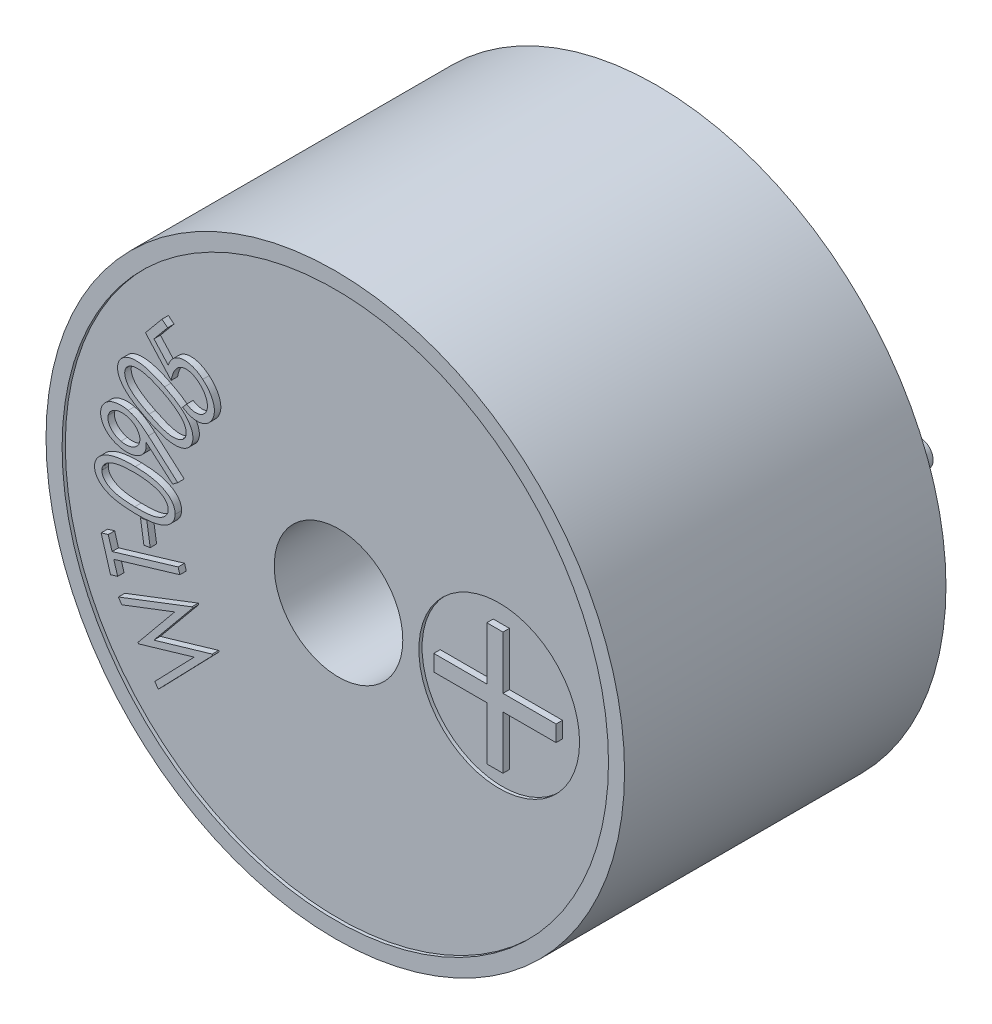
from build123d import *

# Parameters (mm, degrees)
SKETCH_1_R          = 4.5
EXTRUDE_1_DEPTH     = 5
SKETCH_2_R          = 0.2
EXTRUDE_2_DEPTH     = 1.6
SKETCH_3_R          = 4.25
CUT_EXTRUDE_1_DEPTH = 0.05
SKETCH_4_R          = 1.25
CUT_EXTRUDE_2_DEPTH = 0.05
SKETCH_5_R          = 1
CUT_EXTRUDE_3_DEPTH = 5
WRAP_1_DEPTH        = 0.1
WRAP_2_DEPTH        = 0.1


# Read off the part's stored shape, not the designer's step: 包覆1, 包覆2
with BuildPart() as part:
    # 草图1 → 凸台-拉伸1 (new body)
    with BuildSketch(Plane.XY):
        Circle(SKETCH_1_R)
    extrude(amount=EXTRUDE_1_DEPTH)

    # 草图2 → 凸台-拉伸2 (add)
    with BuildSketch(Plane.XY):
        with Locations((2.5, 0)):
            Circle(SKETCH_2_R)
        with Locations(Location((-2.5, 0, 0), (0, 0, 180))):
            Circle(SKETCH_2_R)
    extrude(amount=-EXTRUDE_2_DEPTH)

    # 草图3 → 切除-拉伸1 (cut)
    with BuildSketch(Plane.XY.offset(5)):
        Circle(SKETCH_3_R)
    extrude(amount=-CUT_EXTRUDE_1_DEPTH, mode=Mode.SUBTRACT)

    # 草图4 → 切除-拉伸2 (cut)
    with BuildSketch(Plane.XY.offset(4.95)):
        with Locations((2.5, 0)):
            Circle(SKETCH_4_R)
    extrude(amount=-CUT_EXTRUDE_2_DEPTH, mode=Mode.SUBTRACT)

    # 草图5 → 切除-拉伸3 (cut)
    with BuildSketch(Plane.XY.offset(4.95)):
        Circle(SKETCH_5_R)
    extrude(amount=-CUT_EXTRUDE_3_DEPTH, mode=Mode.SUBTRACT)

    # 包覆1 outline → 包覆1 (add)
    with BuildSketch(Plane.XY.offset(4.9)):
        Polygon((2.608731174, 0.93710624), (2.357449122, 0.93710624), (2.357449122, 0.111465215), (1.531808097, 0.111465215), (1.531808097, -0.139816837), (2.357449122, -0.139816837), (2.357449122, -0.965457862), (2.608731174, -0.965457862), (2.608731174, -0.139816837), (3.434372199, -0.139816837), (3.434372199, 0.111465215), (2.608731174, 0.111465215), align=None)
    extrude(amount=WRAP_1_DEPTH)

    # 包覆2 outline → 包覆2 (add)
    # profile 1 of 7: a face of its own
    with BuildSketch(Plane.XY.offset(4.95)):
        with BuildLine():
            add(Edge.make_bspline(
                [(-2.549833467, 1.979421392), (-2.546206753, 1.989253949), (-2.539241792, 2.008136985), (-2.526923773, 2.034569445), (-2.513423319, 2.058064082), (-2.502788658, 2.071832748), (-2.497670006, 2.078459853)],
                knots=[0, 0, 0, 0, 0.279364044, 0.536507593, 0.776912821, 1, 1, 1, 1], degree=3))
            Line((-2.549833467, 1.979421392), (-2.770506544, 2.221969469))
            Line((-2.770506544, 2.221969469), (-2.558968083, 2.477738699))
            Line((-2.558968083, 2.477738699), (-2.646227698, 2.549854084))
            Line((-2.646227698, 2.549854084), (-2.903198852, 2.239036776))
            Line((-2.903198852, 2.239036776), (-2.503198852, 1.79600793))
            add(Edge.make_bspline(
                [(-2.425314236, 1.990719469), (-2.429687609, 1.985198908), (-2.43873385, 1.973779732), (-2.450213053, 1.954361775), (-2.461369953, 1.933252924), (-2.47145035, 1.909909863), (-2.480831679, 1.88449249), (-2.489069138, 1.856815227), (-2.496920389, 1.827198081), (-2.501064685, 1.806610046), (-2.503198852, 1.79600793)],
                knots=[0, 0, 0, 0, 0.099673624, 0.206173043, 0.318897898, 0.437852815, 0.566072736, 0.702535811, 0.846816372, 1, 1, 1, 1], degree=3))
            add(Edge.make_bspline(
                [(-2.076996929, 1.986392545), (-2.084682232, 1.992520244), (-2.099686259, 2.004483358), (-2.123173131, 2.02006201), (-2.146493565, 2.033722443), (-2.170144829, 2.044825636), (-2.19395828, 2.053529855), (-2.217883043, 2.059754467), (-2.24183146, 2.063978118), (-2.265755124, 2.065616564), (-2.289200962, 2.064970933), (-2.311773004, 2.061825613), (-2.333373759, 2.056349121), (-2.353905797, 2.04804583), (-2.373505148, 2.037399771), (-2.392064084, 2.02435521), (-2.409626059, 2.008835163), (-2.419999009, 1.99685715), (-2.425314236, 1.990719469)],
                knots=[0, 0, 0, 0, 0.075349793, 0.147105497, 0.21593587, 0.282464502, 0.347200759, 0.410102586, 0.471831747, 0.533435363, 0.593687751, 0.651394929, 0.707885133, 0.764144224, 0.820791313, 0.87858677, 0.937786371, 1, 1, 1, 1], degree=3))
            add(Edge.make_bspline(
                [(-1.979400775, 1.615238699), (-1.974823198, 1.621213827), (-1.965747797, 1.63305998), (-1.955219863, 1.652727704), (-1.947207116, 1.673479002), (-1.941504395, 1.695313877), (-1.939373345, 1.718471723), (-1.939291934, 1.742549743), (-1.942084122, 1.767831097), (-1.947412837, 1.793937109), (-1.954842552, 1.820449449), (-1.96548268, 1.84627368), (-1.977918774, 1.871594684), (-1.992808551, 1.896246229), (-2.010643647, 1.91975197), (-2.030319146, 1.942931184), (-2.052486389, 1.965369629), (-2.068721036, 1.979294236), (-2.076996929, 1.986392545)],
                knots=[0, 0, 0, 0, 0.053122328, 0.105319131, 0.156950792, 0.210100275, 0.264191588, 0.320816963, 0.380035844, 0.4435573, 0.508971251, 0.574269909, 0.640618322, 0.708209193, 0.777405772, 0.84889741, 0.922972837, 1, 1, 1, 1], degree=3))
            add(Edge.make_bspline(
                [(-2.263054621, 1.597450238), (-2.253358636, 1.592007407), (-2.234776574, 1.581576387), (-2.206728243, 1.568993262), (-2.180071218, 1.559635923), (-2.154393154, 1.554011551), (-2.129535352, 1.551469234), (-2.104994376, 1.552288124), (-2.080699854, 1.555865981), (-2.05689524, 1.562387362), (-2.034212778, 1.571496198), (-2.013712279, 1.583772035), (-1.994949631, 1.597900611), (-1.984595943, 1.609445715), (-1.979400775, 1.615238699)],
                knots=[0, 0, 0, 0, 0.107249761, 0.205540924, 0.296256509, 0.379367791, 0.45861266, 0.536740654, 0.615690749, 0.695033633, 0.774436774, 0.850686555, 0.925079017, 1, 1, 1, 1], degree=3))
            Line((-2.263054621, 1.597450238), (-2.323871929, 1.523892545))
            add(Edge.make_bspline(
                [(-1.897670006, 1.540479084), (-1.903755882, 1.533427943), (-1.915709734, 1.51957812), (-1.93627187, 1.501772024), (-1.957907621, 1.486219915), (-1.981157947, 1.473424135), (-2.005830426, 1.463248251), (-2.031990131, 1.455887614), (-2.059487621, 1.45070132), (-2.088263922, 1.448700225), (-2.117607086, 1.449231191), (-2.147217773, 1.452066924), (-2.176767787, 1.457723207), (-2.206403639, 1.465565841), (-2.235923949, 1.476350572), (-2.265454445, 1.489508228), (-2.294905867, 1.50554045), (-2.31408395, 1.517691153), (-2.323871929, 1.523892545)],
                knots=[0, 0, 0, 0, 0.059452455, 0.116776264, 0.173326388, 0.229478667, 0.285963838, 0.343499954, 0.40285751, 0.464477855, 0.52747014, 0.59024351, 0.654319155, 0.719530551, 0.785941219, 0.854935169, 0.925962809, 1, 1, 1, 1], degree=3))
            add(Edge.make_bspline(
                [(-2.012093083, 2.056825238), (-1.997642564, 2.044204655), (-1.969253395, 2.019410537), (-1.931838499, 1.977928757), (-1.899598231, 1.934005299), (-1.873103218, 1.887906789), (-1.852461376, 1.841008672), (-1.837728095, 1.794397495), (-1.830848147, 1.748190708), (-1.830191626, 1.710251009), (-1.833415561, 1.68073348), (-1.837537872, 1.659112952), (-1.843343369, 1.638094116), (-1.850488341, 1.617303997), (-1.859970305, 1.597338617), (-1.870822423, 1.577704896), (-1.883327867, 1.558628742), (-1.892849085, 1.546579852), (-1.897670006, 1.540479084)],
                knots=[0, 0, 0, 0, 0.097480096, 0.191507239, 0.283343802, 0.374050145, 0.461250415, 0.543471917, 0.62177566, 0.697965076, 0.735667262, 0.772581999, 0.809743211, 0.846466357, 0.884197148, 0.921947729, 0.960479447, 1, 1, 1, 1], degree=3))
            add(Edge.make_bspline(
                [(-2.497670006, 2.078459853), (-2.490791885, 2.086242101), (-2.47724811, 2.1015662), (-2.454125816, 2.121400756), (-2.42931521, 2.138107785), (-2.402712062, 2.151388189), (-2.374438987, 2.161317073), (-2.344440986, 2.168108441), (-2.312657355, 2.171284193), (-2.279490454, 2.171568913), (-2.245612241, 2.168376482), (-2.211585896, 2.162099221), (-2.177693015, 2.152672548), (-2.144044152, 2.13983173), (-2.110546278, 2.123881966), (-2.077245362, 2.104810963), (-2.044232432, 2.082341595), (-2.022965962, 2.06545753), (-2.012093083, 2.056825238)],
                knots=[0, 0, 0, 0, 0.057412166, 0.113050849, 0.168015982, 0.222541279, 0.277088202, 0.333448207, 0.392299134, 0.453483552, 0.516703056, 0.580269836, 0.644702723, 0.711071159, 0.779291469, 0.849790286, 0.923202485, 1, 1, 1, 1], degree=3))
        make_face()
    # profile 2 of 7: a face of its own
    with BuildSketch(Plane.XY.offset(4.95)):
        with BuildLine():
            add(Edge.make_bspline(
                [(-3.314002577, 1.652138982), (-3.310549109, 1.658721687), (-3.303672879, 1.671828569), (-3.290710332, 1.689746624), (-3.276534084, 1.706528183), (-3.260570898, 1.721647829), (-3.243061118, 1.735519542), (-3.223939782, 1.747980709), (-3.20299232, 1.758762408), (-3.180669547, 1.768500271), (-3.156647903, 1.776276641), (-3.13121873, 1.782663144), (-3.1043477, 1.78689007), (-3.075988048, 1.789236849), (-3.046211192, 1.789902403), (-3.014988246, 1.788974708), (-2.982330601, 1.786008369), (-2.94817487, 1.781103464), (-2.912150096, 1.77451159), (-2.87439926, 1.764818206), (-2.83445244, 1.753432551), (-2.792616134, 1.739132315), (-2.748900092, 1.722220271), (-2.703220544, 1.702950797), (-2.65554433, 1.681268947), (-2.623339535, 1.665520047), (-2.606791039, 1.657427444)],
                knots=[0, 0, 0, 0, 0.028529515, 0.05680537, 0.084757522, 0.112850065, 0.141124244, 0.170501759, 0.200386359, 0.231556567, 0.263978965, 0.297284041, 0.332210493, 0.36836524, 0.406555068, 0.44660002, 0.488329378, 0.532481618, 0.579160581, 0.628968776, 0.682172722, 0.73874203, 0.798780255, 0.862253896, 0.929218896, 1, 1, 1, 1], degree=3))
            add(Edge.make_bspline(
                [(-2.8902045, 1.091802444), (-2.907315659, 1.100532971), (-2.940525299, 1.117477332), (-2.988170219, 1.14353062), (-3.032390925, 1.168919402), (-3.073137638, 1.193855712), (-3.110142888, 1.218615037), (-3.143633985, 1.242847823), (-3.173609071, 1.266688381), (-3.200213336, 1.29024898), (-3.223660771, 1.313971017), (-3.245255349, 1.337102321), (-3.264105629, 1.360749346), (-3.281164919, 1.384117917), (-3.295796193, 1.407575318), (-3.308148974, 1.431159302), (-3.318601719, 1.454604511), (-3.326513885, 1.47822249), (-3.332213676, 1.501562256), (-3.336294108, 1.524430645), (-3.337613316, 1.54699693), (-3.337149148, 1.569020389), (-3.334915114, 1.590663081), (-3.329827764, 1.611664579), (-3.323358675, 1.632408345), (-3.317126205, 1.645551709), (-3.314002577, 1.652138982)],
                knots=[0, 0, 0, 0, 0.07420669, 0.144021663, 0.209753533, 0.271178871, 0.328528619, 0.381714839, 0.430831432, 0.476434717, 0.518897942, 0.559647746, 0.598612538, 0.635640592, 0.671372799, 0.705296072, 0.738423359, 0.770432648, 0.801364098, 0.831185195, 0.860032893, 0.888517922, 0.916240939, 0.943873947, 0.971870392, 1, 1, 1, 1], degree=3))
            add(Edge.make_bspline(
                [(-2.188281423, 1.088437059), (-2.19175553, 1.081947943), (-2.198600139, 1.069163226), (-2.211118493, 1.051432088), (-2.225047092, 1.03510965), (-2.24053193, 1.019973818), (-2.257905442, 1.006613984), (-2.276836129, 0.994532117), (-2.29718563, 0.983668428), (-2.319224234, 0.974631717), (-2.34253193, 0.966799703), (-2.36743385, 0.961148649), (-2.393699031, 0.957082805), (-2.42132358, 0.95465013), (-2.450312951, 0.954286356), (-2.480639528, 0.955525154), (-2.512345743, 0.958378862), (-2.545564785, 0.963281942), (-2.580661022, 0.970276804), (-2.617950674, 0.979992635), (-2.657580308, 0.992390859), (-2.699651992, 1.006983593), (-2.743992432, 1.02449693), (-2.790766005, 1.044362641), (-2.83981709, 1.067072696), (-2.873089375, 1.083402474), (-2.8902045, 1.091802444)],
                knots=[0, 0, 0, 0, 0.028445604, 0.056042918, 0.08374097, 0.111355679, 0.13962347, 0.168336238, 0.198142058, 0.228703582, 0.260358035, 0.293133451, 0.327321593, 0.363095289, 0.400289193, 0.439368102, 0.480444407, 0.523351584, 0.569177893, 0.618787084, 0.672308515, 0.729742413, 0.790975353, 0.856653528, 0.926263171, 1, 1, 1, 1], degree=3))
            add(Edge.make_bspline(
                [(-2.606791039, 1.657427444), (-2.590491769, 1.649078001), (-2.558682624, 1.632783488), (-2.512787362, 1.607920968), (-2.470144592, 1.582887751), (-2.430748674, 1.557879965), (-2.394408003, 1.533243124), (-2.361322206, 1.508576135), (-2.331194278, 1.484264792), (-2.304465845, 1.459530048), (-2.280270803, 1.435122174), (-2.25832171, 1.410918944), (-2.238874744, 1.386635747), (-2.221581154, 1.362466137), (-2.206788662, 1.338211135), (-2.193801319, 1.314104531), (-2.18348068, 1.28986338), (-2.175624945, 1.265676447), (-2.169403806, 1.241960864), (-2.165933132, 1.21850361), (-2.164104007, 1.195600653), (-2.164602697, 1.173137405), (-2.167208223, 1.151140067), (-2.172162168, 1.129706384), (-2.178697546, 1.10854181), (-2.185067088, 1.095179988), (-2.188281423, 1.088437059)],
                knots=[0, 0, 0, 0, 0.070451083, 0.137490129, 0.200772692, 0.260634636, 0.316978843, 0.369629231, 0.419361671, 0.465830634, 0.509643076, 0.551549974, 0.59145926, 0.629264272, 0.665796142, 0.700683545, 0.734521535, 0.766982186, 0.798457487, 0.828713685, 0.85807736, 0.886751763, 0.915007222, 0.943126152, 0.971299099, 1, 1, 1, 1], degree=3))
        make_face()
        with BuildLine():
            add(Edge.make_bspline(
                [(-2.283714116, 1.139879367), (-2.279741827, 1.149282404), (-2.271722564, 1.168265273), (-2.267803605, 1.199821426), (-2.269831121, 1.23305239), (-2.278588027, 1.267902168), (-2.29374823, 1.303850941), (-2.316817217, 1.339734895), (-2.346837013, 1.375772502), (-2.371004922, 1.397935851), (-2.383714116, 1.409590905)],
                knots=[0, 0, 0, 0, 0.098659603, 0.199174197, 0.305113199, 0.420350465, 0.546147021, 0.682070293, 0.832810096, 1, 1, 1, 1], degree=3))
            add(Edge.make_bspline(
                [(-2.848858346, 1.168965905), (-2.834143719, 1.161694327), (-2.805641312, 1.147609193), (-2.763798968, 1.128146538), (-2.724388491, 1.11077836), (-2.687354887, 1.09563848), (-2.652741755, 1.082434911), (-2.620309389, 1.072048041), (-2.590410636, 1.063145807), (-2.562556706, 1.056583017), (-2.536370644, 1.051995709), (-2.511493046, 1.048912864), (-2.487681786, 1.046791568), (-2.464867177, 1.046617104), (-2.443100937, 1.047768591), (-2.422367307, 1.050399663), (-2.402584354, 1.054466789), (-2.378240478, 1.061644344), (-2.350795497, 1.073410805), (-2.322415186, 1.091453875), (-2.29925106, 1.113389594), (-2.288862946, 1.131100849), (-2.283714116, 1.139879367)],
                knots=[0, 0, 0, 0, 0.079401176, 0.153801019, 0.223231005, 0.287729883, 0.34734602, 0.402386971, 0.452439237, 0.498230145, 0.540738318, 0.580982119, 0.619483689, 0.65631164, 0.691253143, 0.724861878, 0.757324367, 0.788847484, 0.847535129, 0.901081551, 0.950971437, 1, 1, 1, 1], degree=3))
            add(Edge.make_bspline(
                [(-3.210637193, 1.604062059), (-3.214604481, 1.594659712), (-3.222644619, 1.575604845), (-3.226630494, 1.543863255), (-3.224144195, 1.510357698), (-3.215670971, 1.475085164), (-3.199993659, 1.43891498), (-3.177194261, 1.402647916), (-3.14744401, 1.366459907), (-3.117389464, 1.33694947), (-3.089095392, 1.313059462), (-3.0641266, 1.294265198), (-3.036146873, 1.274651562), (-3.004796745, 1.254858534), (-2.970373098, 1.234110559), (-2.932738773, 1.212865867), (-2.891958999, 1.19087885), (-2.863553512, 1.176437123), (-2.848858346, 1.168965905)],
                knots=[0, 0, 0, 0, 0.049172908, 0.099654187, 0.152866128, 0.211055009, 0.274261486, 0.342664537, 0.417601537, 0.500368094, 0.546022802, 0.596640774, 0.651475151, 0.71125317, 0.775926769, 0.845872675, 0.920264467, 1, 1, 1, 1], degree=3))
            add(Edge.make_bspline(
                [(-2.643569885, 1.57858129), (-2.656753816, 1.585148395), (-2.682551939, 1.597998809), (-2.72096576, 1.615530465), (-2.758049328, 1.630994065), (-2.79344987, 1.645501352), (-2.827665577, 1.657623024), (-2.860467296, 1.668012577), (-2.891800584, 1.676750608), (-2.921797913, 1.683723116), (-2.950349086, 1.689056811), (-2.977473961, 1.692680304), (-3.003146382, 1.694891485), (-3.027540732, 1.695621138), (-3.050528167, 1.695063609), (-3.072124993, 1.692551085), (-3.092372132, 1.688886022), (-3.116714326, 1.681542543), (-3.144035338, 1.670078414), (-3.172262394, 1.652176792), (-3.19527962, 1.630401613), (-3.205566712, 1.612758369), (-3.210637193, 1.604062059)],
                knots=[0, 0, 0, 0, 0.071288023, 0.139495364, 0.204324339, 0.265756885, 0.324639033, 0.379958378, 0.432274572, 0.482041661, 0.528976234, 0.572801708, 0.614446705, 0.653635423, 0.69088586, 0.725620471, 0.758784422, 0.790323388, 0.848531107, 0.901568308, 0.951483275, 1, 1, 1, 1], degree=3))
            add(Edge.make_bspline(
                [(-2.383714116, 1.409590905), (-2.392239288, 1.416940125), (-2.409665064, 1.431962209), (-2.437235651, 1.45382497), (-2.467001292, 1.475144305), (-2.49835776, 1.496612219), (-2.531888525, 1.51746761), (-2.567355036, 1.538159702), (-2.604635266, 1.558818475), (-2.630466954, 1.571930376), (-2.643569885, 1.57858129)],
                knots=[0, 0, 0, 0, 0.108625054, 0.222033732, 0.339442878, 0.461917905, 0.588730347, 0.72043554, 0.858193019, 1, 1, 1, 1], degree=3))
        make_face(mode=Mode.SUBTRACT)
    # profile 3 of 7: a face of its own
    with BuildSketch(Plane.XY.offset(4.95)):
        with BuildLine():
            add(Edge.make_bspline(
                [(-2.895673387, 0.770448474), (-2.894432136, 0.761649959), (-2.892025235, 0.744588813), (-2.891797818, 0.719387011), (-2.893106588, 0.695578044), (-2.896291423, 0.680438898), (-2.897836849, 0.673092705)],
                knots=[0, 0, 0, 0, 0.271757614, 0.526963548, 0.770461467, 1, 1, 1, 1], degree=3))
            Line((-2.895673387, 0.770448474), (-2.480529156, 0.41035232))
            Line((-2.480529156, 0.41035232), (-2.400961849, 0.469967705))
            Line((-2.400961849, 0.469967705), (-2.858413772, 0.872371551))
            add(Edge.make_bspline(
                [(-3.172596464, 1.057948474), (-3.160521789, 1.054682822), (-3.136084289, 1.048073585), (-3.099870658, 1.034629449), (-3.063623282, 1.018229495), (-3.02658175, 0.998662083), (-2.988161518, 0.974662265), (-2.947247753, 0.945573812), (-2.903345543, 0.911270911), (-2.873844075, 0.885730226), (-2.858413772, 0.872371551)],
                knots=[0, 0, 0, 0, 0.101773153, 0.20597503, 0.313985532, 0.425438472, 0.546701886, 0.682419625, 0.833894319, 1, 1, 1, 1], degree=3))
            add(Edge.make_bspline(
                [(-3.594471464, 0.869006166), (-3.590998911, 0.881283343), (-3.584111396, 0.905634084), (-3.565725794, 0.939052493), (-3.543066454, 0.97016828), (-3.514432334, 0.997561639), (-3.481629758, 1.021762543), (-3.44432889, 1.040886336), (-3.403565534, 1.056076369), (-3.359359555, 1.065693311), (-3.313304649, 1.071283083), (-3.266433476, 1.071899203), (-3.219233773, 1.068079664), (-3.188244387, 1.061347728), (-3.172596464, 1.057948474)],
                knots=[0, 0, 0, 0, 0.074444802, 0.147654965, 0.221748901, 0.299015856, 0.378554697, 0.459518441, 0.543493983, 0.632455416, 0.723601152, 0.814586305, 0.906376359, 1, 1, 1, 1], degree=3))
            add(Edge.make_bspline(
                [(-3.30625031, 0.499294628), (-3.322466496, 0.503682298), (-3.354135925, 0.512251206), (-3.399039394, 0.530649109), (-3.440507686, 0.552601871), (-3.47805104, 0.578726721), (-3.511738113, 0.607765618), (-3.53981491, 0.640690406), (-3.563984943, 0.675661722), (-3.581919541, 0.713597051), (-3.594848464, 0.752568929), (-3.601505777, 0.791876288), (-3.60171469, 0.831004594), (-3.596890649, 0.856313914), (-3.594471464, 0.869006166)],
                knots=[0, 0, 0, 0, 0.096783611, 0.189013733, 0.279134428, 0.366796124, 0.452244421, 0.534781527, 0.615639906, 0.696644667, 0.775834556, 0.851713843, 0.925636675, 1, 1, 1, 1], degree=3))
            add(Edge.make_bspline(
                [(-2.897836849, 0.673092705), (-2.900263311, 0.664365158), (-2.90506557, 0.647092294), (-2.916064676, 0.622577233), (-2.930079935, 0.599957423), (-2.946867582, 0.579046538), (-2.966444864, 0.559950581), (-2.989063045, 0.542844029), (-3.0144669, 0.527460274), (-3.042357558, 0.513862348), (-3.072176969, 0.502734899), (-3.103124874, 0.494018107), (-3.134885327, 0.487929401), (-3.167561234, 0.484982922), (-3.201069839, 0.48412413), (-3.235483174, 0.486369024), (-3.270721138, 0.491502598), (-3.294259364, 0.49666485), (-3.30625031, 0.499294628)],
                knots=[0, 0, 0, 0, 0.055169609, 0.109187289, 0.1631475, 0.217012534, 0.272288029, 0.329448454, 0.389522099, 0.453102724, 0.518343348, 0.583301679, 0.648934384, 0.715191391, 0.783113265, 0.853111679, 0.925171509, 1, 1, 1, 1], degree=3))
        make_face()
        with BuildLine():
            add(Edge.make_bspline(
                [(-3.191586849, 0.969246551), (-3.199900707, 0.971029396), (-3.216282162, 0.974542278), (-3.240844818, 0.978012435), (-3.264897155, 0.979171821), (-3.288446225, 0.978447388), (-3.31156635, 0.975911916), (-3.334104891, 0.970955961), (-3.356294102, 0.96452536), (-3.377528786, 0.955881144), (-3.397709932, 0.946020572), (-3.415813242, 0.934335399), (-3.43212314, 0.921585811), (-3.44633213, 0.907384131), (-3.458485144, 0.891906298), (-3.468423942, 0.875070946), (-3.47644756, 0.856995668), (-3.48011632, 0.844217548), (-3.481971464, 0.837756166)],
                knots=[0, 0, 0, 0, 0.072182498, 0.142226912, 0.210345049, 0.276368758, 0.342107934, 0.407490587, 0.472068345, 0.538014895, 0.601908128, 0.6624882, 0.720607785, 0.777373692, 0.832627333, 0.887232147, 0.94297783, 1, 1, 1, 1], degree=3))
            add(Edge.make_bspline(
                [(-2.994471464, 0.718765782), (-2.993104823, 0.7253109), (-2.990391351, 0.738306261), (-2.989255269, 0.758040912), (-2.990575596, 0.777530592), (-2.993718486, 0.796940946), (-3.000278368, 0.815930768), (-3.008733838, 0.834876879), (-3.019540412, 0.853616946), (-3.032834803, 0.871755665), (-3.047721059, 0.8891115), (-3.064306074, 0.905090892), (-3.082012697, 0.919831163), (-3.101302641, 0.932799845), (-3.121983686, 0.944099982), (-3.143817621, 0.954301578), (-3.167195925, 0.962668205), (-3.183381194, 0.967033447), (-3.191586849, 0.969246551)],
                knots=[0, 0, 0, 0, 0.056725826, 0.112629377, 0.167174539, 0.222440789, 0.279035854, 0.337212497, 0.39849032, 0.462329262, 0.527945972, 0.592430844, 0.657690198, 0.72337039, 0.789465238, 0.857666851, 0.927839521, 1, 1, 1, 1], degree=3))
            add(Edge.make_bspline(
                [(-3.284615695, 0.587996551), (-3.276309984, 0.586084204), (-3.259970184, 0.58232205), (-3.23533299, 0.579325989), (-3.211309828, 0.578050736), (-3.187752272, 0.578786817), (-3.16474229, 0.581376078), (-3.1421649, 0.586049103), (-3.120048018, 0.592414722), (-3.098780257, 0.601111975), (-3.078767439, 0.611342466), (-3.060393602, 0.622797931), (-3.044196043, 0.635694858), (-3.029751353, 0.649526304), (-3.018027639, 0.665260426), (-3.007792411, 0.681794475), (-2.999719702, 0.69973071), (-2.996231825, 0.712381051), (-2.994471464, 0.718765782)],
                knots=[0, 0, 0, 0, 0.072455792, 0.142542072, 0.210787895, 0.276935364, 0.342797767, 0.407496575, 0.472849122, 0.538286921, 0.602607634, 0.663876462, 0.722104991, 0.778497396, 0.833437606, 0.888496077, 0.943723052, 1, 1, 1, 1], degree=3))
            add(Edge.make_bspline(
                [(-3.481971464, 0.837756166), (-3.48334036, 0.831210505), (-3.486041919, 0.818292441), (-3.487158181, 0.798648485), (-3.485990027, 0.779271636), (-3.482294868, 0.760065764), (-3.476253616, 0.741024709), (-3.467753294, 0.722169749), (-3.456761488, 0.703559547), (-3.443688471, 0.6852741), (-3.42871654, 0.667807318), (-3.411886572, 0.652014022), (-3.39428828, 0.637104364), (-3.374739051, 0.624548972), (-3.354366107, 0.612778299), (-3.332305731, 0.603028427), (-3.309019141, 0.594549211), (-3.292825563, 0.590201013), (-3.284615695, 0.587996551)],
                knots=[0, 0, 0, 0, 0.056800245, 0.112097034, 0.166713754, 0.221504461, 0.277964471, 0.336217435, 0.396986401, 0.461462328, 0.52716512, 0.592225265, 0.657570232, 0.722957816, 0.789471762, 0.857480125, 0.927744854, 1, 1, 1, 1], degree=3))
        make_face(mode=Mode.SUBTRACT)
    # profile 4 of 7: a face of its own
    with BuildSketch(Plane.XY.offset(4.95)):
        with BuildLine():
            add(Edge.make_bspline(
                [(-3.695022656, 0.046498474), (-3.694706851, 0.053966571), (-3.694081857, 0.068746349), (-3.690254396, 0.09053116), (-3.68479292, 0.111813633), (-3.677096441, 0.132540393), (-3.667062065, 0.152548891), (-3.655342349, 0.172133105), (-3.64120424, 0.190939269), (-3.625105196, 0.209242193), (-3.606810503, 0.226717976), (-3.586622405, 0.243358972), (-3.56419508, 0.258818079), (-3.539825705, 0.273434343), (-3.513235506, 0.286808355), (-3.484827121, 0.29944737), (-3.454121609, 0.310557664), (-3.42141444, 0.321281324), (-3.386127704, 0.330688785), (-3.348079755, 0.338550667), (-3.307243268, 0.344990637), (-3.263523172, 0.349946081), (-3.217031409, 0.353810976), (-3.167723841, 0.356138351), (-3.115617533, 0.357138152), (-3.079958425, 0.356620574), (-3.061609194, 0.356354243)],
                knots=[0, 0, 0, 0, 0.02875911, 0.056915868, 0.084984552, 0.113301508, 0.141869581, 0.171083714, 0.201079516, 0.232345349, 0.264865295, 0.298411558, 0.332996364, 0.3696726, 0.407763919, 0.447557273, 0.489346709, 0.533457615, 0.580092408, 0.629902736, 0.68302163, 0.739252222, 0.799323144, 0.862660581, 0.929328782, 1, 1, 1, 1], degree=3))
            add(Edge.make_bspline(
                [(-3.073868809, -0.277059219), (-3.09294276, -0.276593746), (-3.130066627, -0.27568779), (-3.184011387, -0.272792495), (-3.234680666, -0.268773573), (-3.281880333, -0.263438102), (-3.325804798, -0.257428241), (-3.366246072, -0.249566194), (-3.403464068, -0.241158394), (-3.437475635, -0.231203158), (-3.468707151, -0.220029108), (-3.497779798, -0.207972069), (-3.525119386, -0.195336487), (-3.550335187, -0.181424791), (-3.573543926, -0.166373274), (-3.594980511, -0.150660891), (-3.614293013, -0.133707695), (-3.631641457, -0.11599586), (-3.646769552, -0.097382836), (-3.660086628, -0.078423039), (-3.671304357, -0.058829347), (-3.680071654, -0.038602872), (-3.687218627, -0.018078025), (-3.692040294, 0.003035125), (-3.6946936, 0.024632828), (-3.694912818, 0.039199779), (-3.695022656, 0.046498474)],
                knots=[0, 0, 0, 0, 0.073922709, 0.143876695, 0.209287702, 0.270829581, 0.327907943, 0.381003875, 0.430406904, 0.475697619, 0.518217774, 0.55886503, 0.597614789, 0.634856401, 0.670336493, 0.70473656, 0.737739481, 0.769794184, 0.800681977, 0.830567393, 0.859487371, 0.887984303, 0.915867481, 0.943582493, 0.971732303, 1, 1, 1, 1], degree=3))
            add(Edge.make_bspline(
                [(-2.441416886, 0.022700397), (-2.441761631, 0.015396357), (-2.442446951, 0.000876632), (-2.445885511, -0.020630826), (-2.451311516, -0.041540544), (-2.459274366, -0.061711514), (-2.468790649, -0.08140109), (-2.480472863, -0.100546429), (-2.494178342, -0.119095198), (-2.510155418, -0.136824597), (-2.527861252, -0.153933743), (-2.547771882, -0.169886911), (-2.569664501, -0.184638505), (-2.59339964, -0.198815777), (-2.619313914, -0.211536207), (-2.647049942, -0.223757657), (-2.676930374, -0.234382033), (-2.708861302, -0.244417725), (-2.74345987, -0.25304733), (-2.781092419, -0.260426707), (-2.821966198, -0.266794917), (-2.866211659, -0.271011343), (-2.913559426, -0.274813383), (-2.96415633, -0.276770916), (-3.017936463, -0.277863862), (-3.054878209, -0.277332418), (-3.073868809, -0.277059219)],
                knots=[0, 0, 0, 0, 0.028329013, 0.056315338, 0.084268889, 0.111901293, 0.140242226, 0.168956916, 0.198716175, 0.229517474, 0.261373679, 0.294071437, 0.328276388, 0.363650422, 0.401158677, 0.440111903, 0.481088435, 0.524024438, 0.569831011, 0.619237343, 0.672659056, 0.730119512, 0.79149142, 0.856784306, 0.926377272, 1, 1, 1, 1], degree=3))
            add(Edge.make_bspline(
                [(-3.061609194, 0.356354243), (-3.043337109, 0.355881614), (-3.00781608, 0.354962822), (-2.955937855, 0.352156793), (-2.906985674, 0.347699724), (-2.860843896, 0.342633898), (-2.817607336, 0.335908084), (-2.777391109, 0.327688629), (-2.739847727, 0.318705425), (-2.705241844, 0.30805974), (-2.673037939, 0.296403819), (-2.642901832, 0.284080856), (-2.61505707, 0.270187274), (-2.589009091, 0.256012724), (-2.565299222, 0.240367301), (-2.54339274, 0.224175146), (-2.523573919, 0.206840843), (-2.50603896, 0.188455106), (-2.490334583, 0.169625623), (-2.477104082, 0.149940942), (-2.465689153, 0.13000622), (-2.456481659, 0.109480041), (-2.449558557, 0.088426635), (-2.444337581, 0.066996998), (-2.441755084, 0.044961584), (-2.441530181, 0.030157818), (-2.441416886, 0.022700397)],
                knots=[0, 0, 0, 0, 0.070500856, 0.137054038, 0.200349004, 0.26007847, 0.316074511, 0.369050717, 0.418375014, 0.464912174, 0.508613432, 0.550456579, 0.59040303, 0.628587708, 0.664763267, 0.69987352, 0.73360026, 0.766169996, 0.797788792, 0.828049123, 0.857529153, 0.886305752, 0.914649217, 0.942911683, 0.971241664, 1, 1, 1, 1], degree=3))
        make_face()
        with BuildLine():
            add(Edge.make_bspline(
                [(-2.549109194, 0.027988858), (-2.549636317, 0.038230428), (-2.550695399, 0.058807542), (-2.560370869, 0.089099122), (-2.576737203, 0.118010098), (-2.595179765, 0.140715672), (-2.613046113, 0.157856785), (-2.628290176, 0.170543801), (-2.645399735, 0.182130858), (-2.663962459, 0.193400647), (-2.684444952, 0.203282562), (-2.706398101, 0.212728784), (-2.729992032, 0.221396563), (-2.746438269, 0.226388533), (-2.754878425, 0.228950397)],
                knots=[0, 0, 0, 0, 0.099240638, 0.19939187, 0.305254103, 0.420312902, 0.481933795, 0.545483904, 0.612595963, 0.682374002, 0.756132391, 0.833154088, 0.91437521, 1, 1, 1, 1], degree=3))
            add(Edge.make_bspline(
                [(-3.069782271, -0.189318834), (-3.053436098, -0.189558413), (-3.021785315, -0.190022306), (-2.975867073, -0.189400942), (-2.932970748, -0.188451762), (-2.893231836, -0.185876246), (-2.856474215, -0.183004475), (-2.822835376, -0.178516388), (-2.79214609, -0.173702348), (-2.764320288, -0.167582579), (-2.738815716, -0.160559183), (-2.715089777, -0.152629758), (-2.69280872, -0.144008531), (-2.672196434, -0.134405345), (-2.653043771, -0.12404176), (-2.635446824, -0.112814084), (-2.619557726, -0.100448361), (-2.60071373, -0.08354885), (-2.580881091, -0.061216423), (-2.563302851, -0.03250091), (-2.551464404, -0.002777583), (-2.549889991, 0.017789191), (-2.549109194, 0.027988858)],
                knots=[0, 0, 0, 0, 0.079278634, 0.153505701, 0.222704155, 0.287329043, 0.346612198, 0.401464314, 0.451870363, 0.497223739, 0.539554618, 0.580107252, 0.618498305, 0.655356142, 0.690308734, 0.72404781, 0.756460578, 0.787829216, 0.846758515, 0.900475637, 0.950642946, 1, 1, 1, 1], degree=3))
            add(Edge.make_bspline(
                [(-3.581080348, 0.047700397), (-3.580665841, 0.037453681), (-3.579828656, 0.016758251), (-3.569780622, -0.013662569), (-3.553150588, -0.042834142), (-3.534570141, -0.065932495), (-3.516502331, -0.083389637), (-3.500969109, -0.095882663), (-3.484028117, -0.107829268), (-3.465279879, -0.118726139), (-3.445059021, -0.129080659), (-3.423312955, -0.138710975), (-3.399998306, -0.147646198), (-3.374760388, -0.155527911), (-3.347233554, -0.162965043), (-3.316755392, -0.168947132), (-3.28319541, -0.174632283), (-3.246498624, -0.178885154), (-3.206792046, -0.18324718), (-3.163873048, -0.185867256), (-3.117876725, -0.188093351), (-3.086130905, -0.188902259), (-3.069782271, -0.189318834)],
                knots=[0, 0, 0, 0, 0.049561989, 0.100101013, 0.153536101, 0.211887927, 0.243233681, 0.27529464, 0.30851568, 0.343722676, 0.380411941, 0.418703929, 0.459067644, 0.501489215, 0.546945132, 0.597346381, 0.652123893, 0.71206664, 0.77655761, 0.845920427, 0.920651271, 1, 1, 1, 1], degree=3))
            add(Edge.make_bspline(
                [(-3.06088804, 0.269335012), (-3.075551337, 0.269586709), (-3.104238134, 0.27007912), (-3.146239864, 0.269262884), (-3.18623745, 0.267625802), (-3.224158068, 0.265020952), (-3.26007221, 0.261408294), (-3.294017552, 0.256945273), (-3.325931899, 0.25118738), (-3.355808948, 0.24438535), (-3.383780323, 0.237055941), (-3.409736027, 0.228588879), (-3.4338404, 0.219521738), (-3.456033184, 0.209577658), (-3.476538947, 0.199225491), (-3.494861902, 0.187471881), (-3.511530764, 0.175411733), (-3.530318142, 0.158299945), (-3.550008245, 0.136187862), (-3.567526805, 0.107698616), (-3.578536846, 0.078035453), (-3.580240098, 0.057721633), (-3.581080348, 0.047700397)],
                knots=[0, 0, 0, 0, 0.071187718, 0.139269342, 0.203897522, 0.265505237, 0.323756314, 0.379098302, 0.431668292, 0.481116291, 0.52782152, 0.571982394, 0.613594239, 0.652773305, 0.690003858, 0.724968874, 0.758344234, 0.789743434, 0.84818123, 0.901416191, 0.951366523, 1, 1, 1, 1], degree=3))
            add(Edge.make_bspline(
                [(-2.754878425, 0.228950397), (-2.76567285, 0.231925745), (-2.787713156, 0.23800088), (-2.821904823, 0.245566687), (-2.857715821, 0.252388398), (-2.895194562, 0.25775748), (-2.934292392, 0.262456713), (-2.975037418, 0.265658987), (-3.017433918, 0.268138402), (-3.04622138, 0.268931132), (-3.06088804, 0.269335012)],
                knots=[0, 0, 0, 0, 0.108506612, 0.2215513, 0.339292221, 0.461753673, 0.588427475, 0.720898781, 0.857803284, 1, 1, 1, 1], degree=3))
        make_face(mode=Mode.SUBTRACT)
    # profile 5 of 7: a face of its own
    with BuildSketch(Plane.XY.offset(4.95)):
        Polygon((-2.882882827, -0.276897215), (-2.98095975, -0.29228183), (-2.927113596, -0.635070292), (-2.829036673, -0.619685676), align=None)
    # profile 6 of 7: a face of its own
    with BuildSketch(Plane.XY.offset(4.95)):
        Polygon((-3.592706209, -0.802453118), (-3.446552363, -1.293318502), (-3.33597544, -1.26038581), (-3.395590824, -1.06038581), (-2.367946593, -0.75413581), (-2.395110055, -0.662789656), (-3.422754286, -0.969039656), (-3.482129286, -0.769520425), align=None)
    # profile 7 of 7: a face of its own
    with BuildSketch(Plane.XY.offset(4.95)):
        Polygon((-2.144635488, -1.75248215), (-2.756895104, -2.385655227), (-2.704250873, -2.46498215), (-1.854731642, -1.586135996), (-1.864347027, -1.571472535), (-2.772279719, -1.837097535), (-2.172039334, -1.108251381), (-2.181895104, -1.093347535), (-3.323962411, -1.532049458), (-3.271558565, -1.610895611), (-2.448241257, -1.295510996), (-3.019154719, -1.990703304), (-3.00881818, -2.006328304), align=None)
    extrude(amount=WRAP_2_DEPTH)


solid = part.part
